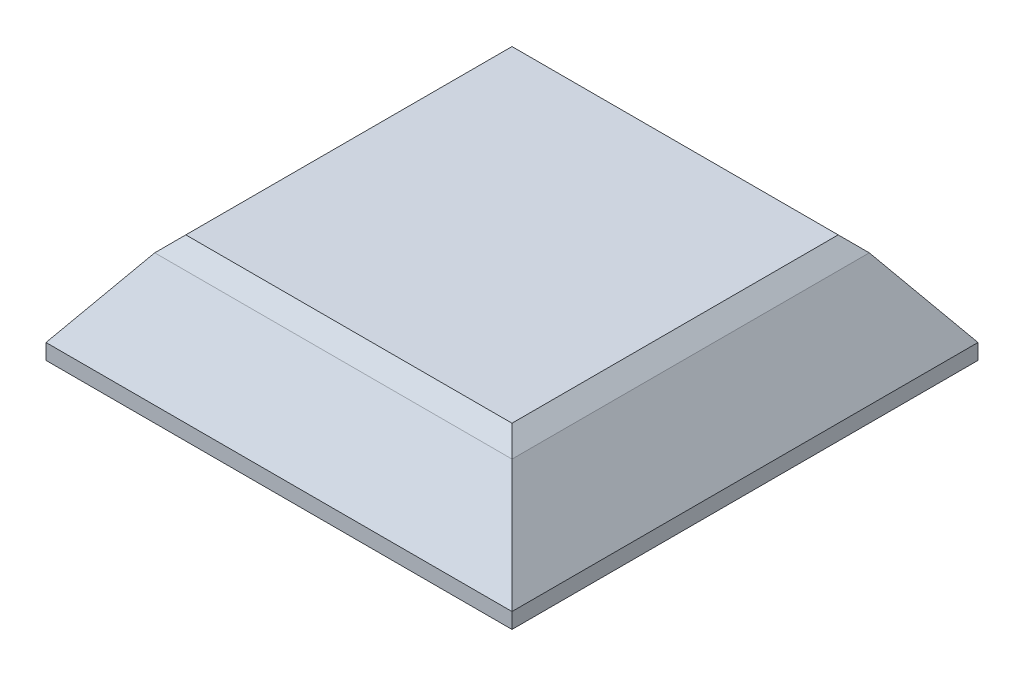
from build123d import *

# Parameters (mm, degrees)
SKETCH1_W           = 60
SKETCH1_H           = 60
BOSS_EXTRUDE1_DEPTH = 2
BOSS_EXTRUDE2_START = -12
SKETCH1_18_W        = 46
SKETCH1_18_H        = 46
BOSS_EXTRUDE2_DEPTH = 2
CHAMFER1_SIZE       = 2
SKETCH1_19_W        = 46
SKETCH1_19_H        = 46
CUT_EXTRUDE4_DEPTH  = 8
CHAMFER2_SIZE       = 5
SKETCH1_21_R        = 4.5
CUT_EXTRUDE5_DEPTH  = 5
FILLET1_R           = 1.5
SKETCH1_22_W        = 2
SKETCH1_22_H        = 19
BOSS_EXTRUDE3_DEPTH = 15
FILLET2_R           = 1.5


with BuildPart() as part:
    # Sketch1 → Boss-Extrude1 (new body)
    with BuildSketch(Plane.XZ):
        with Locations((-57.275008644, -55.577648407)):
            Rectangle(SKETCH1_W, SKETCH1_H)
    extrude(amount=-BOSS_EXTRUDE1_DEPTH)



with BuildPart() as body_2:
    # Sketch1<18> → Boss-Extrude2 (new body)
    with BuildSketch(Plane.XZ.offset(BOSS_EXTRUDE2_START)):
        with Locations((-57.275008644, -55.577648407)):
            Rectangle(SKETCH1_18_W, SKETCH1_18_H)
    extrude(amount=-BOSS_EXTRUDE2_DEPTH)


with BuildPart() as part_1:
    add(part.part)

    add(body_2.part)  # loft1 joins it to this body
    # loft from a face of the part (loft1)
    loft([part_1.faces().sort_by_distance((-57.275008644, 2, -55.577648407))[0], part_1.faces().sort_by_distance((-57.275008644, 12, -55.577648407))[0]])

    # Chamfer1
    chamfer1_edges = [part_1.edges().sort_by_distance(p)[0] for p in [
        (-57.275008644, 14, -32.577648407),
        (-34.275008644, 14, -55.577648407),
        (-57.275008644, 14, -78.577648407),
        (-80.275008644, 14, -55.577648407),
    ]]
    chamfer(chamfer1_edges, length=CHAMFER1_SIZE - 0.0001)  # a hair under: the kernel refuses the full size

    # Sketch1<19> → Cut-Extrude4 (cut)
    with BuildSketch(Plane.XZ):
        with Locations((-57.275008644, -55.577648407)):
            Rectangle(SKETCH1_19_W, SKETCH1_19_H)
    extrude(amount=-CUT_EXTRUDE4_DEPTH, mode=Mode.SUBTRACT)

    # Chamfer2
    chamfer2_edges = [part_1.edges().sort_by_distance(p)[0] for p in [
        (-57.275008644, 8, -32.577648407),
        (-80.275008644, 8, -55.577648407),
        (-34.275008644, 8, -55.577648407),
        (-57.275008644, 8, -78.577648407),
    ]]
    chamfer(chamfer2_edges, length=CHAMFER2_SIZE)

    # Sketch1<21> → Cut-Extrude5 (cut)
    with BuildSketch(Plane.XZ):
        with Locations((-34.275008644, -32.577648407)):
            Circle(SKETCH1_21_R)
        with Locations((-80.275008644, -32.577648407)):
            Circle(SKETCH1_21_R)
        with Locations((-80.275008644, -78.577648407)):
            Circle(SKETCH1_21_R)
        with Locations((-34.275008644, -78.577648407)):
            Circle(SKETCH1_21_R)
    extrude(amount=-CUT_EXTRUDE5_DEPTH, mode=Mode.SUBTRACT)

    # Fillet1
    fillet1_edges = [part_1.edges().sort_by_distance(p)[0] for p in [
        (-83.45698916, 5, -81.759628922),
        (-83.45698916, 5, -29.395667891),
        (-31.093028129, 5, -81.759628922),
    ]]
    fillet(fillet1_edges, radius=FILLET1_R)

    # Sketch1<22> → Boss-Extrude3 (add)
    with BuildSketch(Plane.XZ):
        with Locations((-83.275008644, -56.378641634)):
            Rectangle(SKETCH1_22_W, SKETCH1_22_H)
    extrude(amount=BOSS_EXTRUDE3_DEPTH)

    # Fillet2
    fillet2_edges = [part_1.edges().sort_by_distance(p)[0] for p in [
        (-84.275008644, 0, -56.378641634),
        (-82.275008644, 0, -56.378641634),
    ]]
    fillet(fillet2_edges, radius=FILLET2_R)


solid = part_1.part
